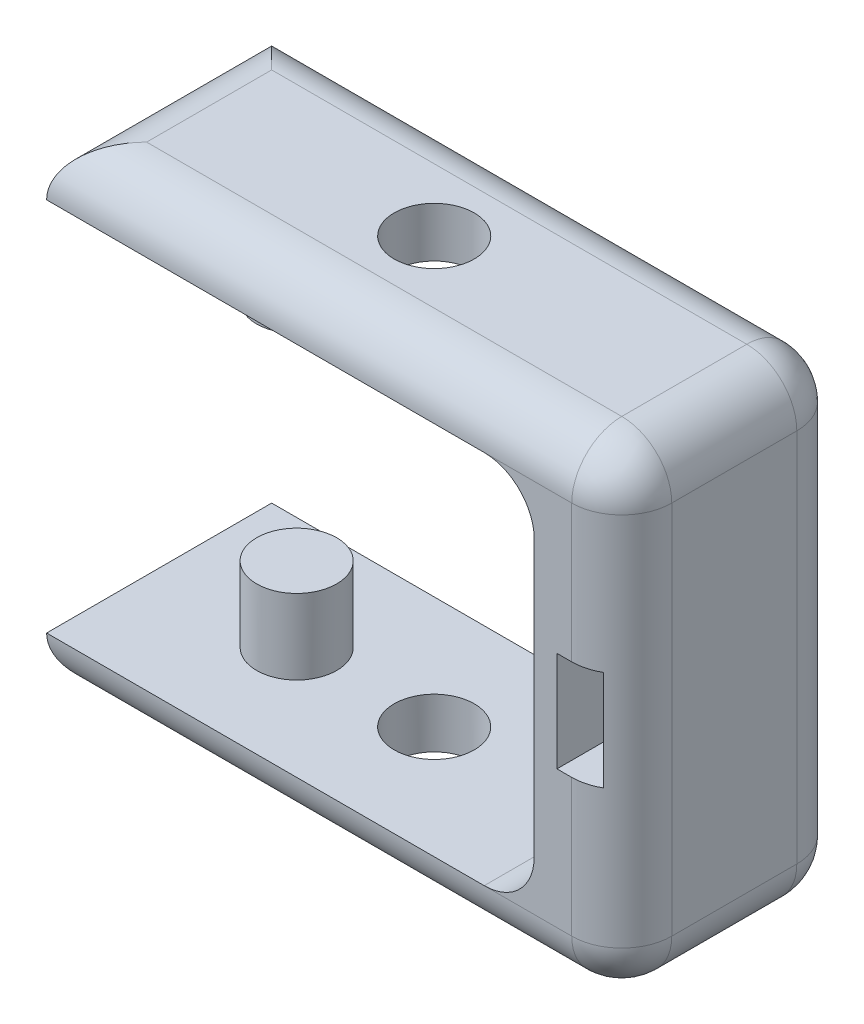
from build123d import *

# Parameters (mm, degrees)
SKETCH1_W      = 23
SKETCH1_H      = 9
EXTRUDE1_DEPTH = 19
SKETCH2_R      = 1.6
EXTRUDE2_DEPTH = 23.888930821
SKETCH3_W      = 19.5
SKETCH3_H      = 15
EXTRUDE3_DEPTH = 25.02759827
SKETCH6_R      = 1.6
EXTRUDE4_DEPTH = 3
EXTRUDE5_START = 3
SKETCH7_R      = 1.6
EXTRUDE5_DEPTH = 3
FILLET1_R      = 2
SKETCH8_W      = 1.59
SKETCH8_H      = 4
EXTRUDE6_DEPTH = 6
SKETCH9_W      = 1.19
SKETCH9_H      = 3.6
EXTRUDE7_DEPTH = 24.072179755


with BuildPart() as part:
    # Sketch1 → Extrude1 (new body)
    with BuildSketch(Plane(origin=(0, 0, 0), x_dir=(1, 0, 0), z_dir=(0, 1, 0))):
        with Locations((-0.132947977, 0.751445087)):
            Rectangle(SKETCH1_W, SKETCH1_H)
    extrude(amount=EXTRUDE1_DEPTH)

    # Sketch2 → Extrude2 (cut, through all)
    with BuildSketch(Plane(origin=(0, 19, 0), x_dir=(1, 0, 0), z_dir=(0, 1, 0))):
        with Locations(Location((-0.632947977, 0.751445087, 0), (0, 0, 270))):
            Circle(SKETCH2_R)
    extrude(amount=-EXTRUDE2_DEPTH, mode=Mode.SUBTRACT)

    # Sketch3 → Extrude3 (cut, through all)
    with BuildSketch(Plane.XY.offset(3.748554913)):
        with Locations((-1.882947977, 9.5)):
            Rectangle(SKETCH3_W, SKETCH3_H)
    extrude(amount=-EXTRUDE3_DEPTH, mode=Mode.SUBTRACT)

    # Sketch6 → Extrude4 (add)
    with BuildSketch(Plane(origin=(0, 2, 0), x_dir=(1, 0, 0), z_dir=(0, 1, 0))):
        with Locations(Location((-6.132947977, 0.751445087, 0), (0, 0, 90))):
            Circle(SKETCH6_R)
    extrude(amount=EXTRUDE4_DEPTH)

    # Sketch7 → Extrude5 (add)
    with BuildSketch(Plane.XZ.offset(-17).offset(EXTRUDE5_START)):
        with Locations(Location((-6.132947977, -0.751445087, 0), (0, 0, 270))):
            Circle(SKETCH7_R)
    extrude(amount=-EXTRUDE5_DEPTH)

    # Fillet1
    fillet1_edges = [part.edges().sort_by_distance(p)[0] for p in [
        (11.367052023, 19, -0.751445087),
        (-0.132947977, 19, -5.251445087),
        (7.867052023, 2, -0.751445087),
        (7.867052023, 17, -0.751445087),
        (-11.632947977, 19, -0.751445087),
        (-0.132947977, 0, -5.251445087),
        (11.367052023, 0, -0.751445087),
        (-0.132947977, 0, 3.748554913),
        (-11.632947977, 0, -0.751445087),
        (-0.132947977, 19, 3.748554913),
        (11.367052023, 9.5, -5.251445087),
        (11.367052023, 9.5, 3.748554913),
    ]]
    fillet(fillet1_edges, radius=FILLET1_R - 0.0001)  # a hair under: the kernel refuses the full size

    # Sketch8 → Extrude6 (cut)
    with BuildSketch(Plane.XY.offset(3.748554913)):
        with Locations((9.572052023, 9.5)):
            Rectangle(SKETCH8_W, SKETCH8_H)
    extrude(amount=-EXTRUDE6_DEPTH, mode=Mode.SUBTRACT)

    # Sketch9 → Extrude7 (cut, through all)
    with BuildSketch(Plane.XY.offset(-2.251445087)):
        with Locations((9.572052023, 9.5)):
            Rectangle(SKETCH9_W, SKETCH9_H)
    extrude(amount=-EXTRUDE7_DEPTH, mode=Mode.SUBTRACT)


solid = part.part
